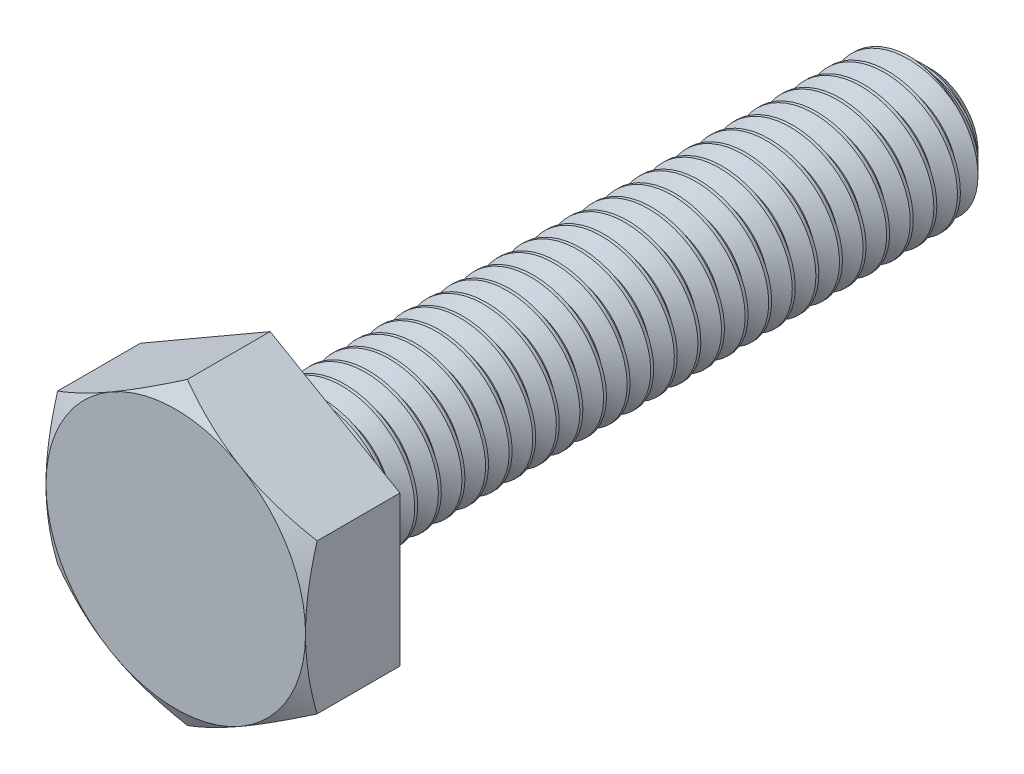
from build123d import *
from build123d.topology import SkipClean

# Parameters (mm, degrees)
SKETCH2_R           = 1.5
BOSS_EXTRUDE1_DEPTH = 14
BOSS_EXTRUDE2_DEPTH = 2
SKETCH4_OUTSIDE_W   = 71.882
SKETCH4_OUTSIDE_H   = 72.732
SKETCH4_OUTSIDE_R   = 2.75
CUT_EXTRUDE1_DEPTH  = 17.542243903
CUT_EXTRUDE1_DRAFT  = -60
CHAMFER1_SIZE       = 0.5
CUT_SWEEP2_PITCH    = 0.5
SKETCH7_R           = 1.5
BOSS_EXTRUDE5_DEPTH = 2


with BuildPart() as part:
    # Sketch2 → Boss-Extrude1 (new body)
    with BuildSketch(Plane.XY.offset(7)):
        Circle(SKETCH2_R)
    extrude(amount=-BOSS_EXTRUDE1_DEPTH)

    # Chamfer1
    chamfer1_edges = [part.edges().sort_by_distance(p)[0] for p in [
        (-1.5, 0, -7),
    ]]
    chamfer(chamfer1_edges, length=CHAMFER1_SIZE)

    # Cut-Sweep2: the profile of Sketch8 screwed along a right-hand helix of 29 turns, 6 arcs to a turn; built about Z, then put on its axis
    cut_sweep2_z = Axis((0, 0, 0), (0, 0, 1))
    cut_sweep2_corners = [(1.527063294, 0, 0.015625), (1.527063294, 0, -0.453125), (1.175240474, 0, -0.25), (1.175240474, 0, -0.1875)]
    with BuildLine(mode=Mode.PRIVATE) as cut_sweep2_profile:
        Line(cut_sweep2_corners[0], cut_sweep2_corners[1])
        Line(cut_sweep2_corners[1], cut_sweep2_corners[2])
        Line(cut_sweep2_corners[2], cut_sweep2_corners[3])
        Line(cut_sweep2_corners[3], cut_sweep2_corners[0])
    cut_sweep2_cap = Face(cut_sweep2_profile.wire())
    cut_sweep2_turn_angles = [0, 30, 60, 90, 120, 150, 180, 210, 240, 270, 300, 330, 360]
    cut_sweep2_turn_weights = [1, 0.8660254037844387, 1, 0.8660254037844387, 1, 0.8660254037844387, 1, 0.8660254037844387, 1, 0.8660254037844387, 1, 0.8660254037844387, 1]
    cut_sweep2_turn_rails = [Edge.make_bspline([Vector(p[0], p[1], 0).rotate(cut_sweep2_z, cut_sweep2_turn_angles[k]) / cut_sweep2_turn_weights[k] + Vector(0, 0, p[2] + CUT_SWEEP2_PITCH * cut_sweep2_turn_angles[k] / 360) for k in range(13)], [0, 0, 0, 1, 1, 2, 2, 3, 3, 4, 4, 5, 5, 6, 6, 6], 2, cut_sweep2_turn_weights) for p in cut_sweep2_corners]
    cut_sweep2_turn_sides = [Face.make_surface_from_curves(cut_sweep2_turn_rails[p[0]], cut_sweep2_turn_rails[p[1]]) for p in [(0, 1), (1, 2), (2, 3), (3, 0)]]
    cut_sweep2 = Plane(origin=(0, 0, -7), x_dir=(0, 1, 0), z_dir=(0, 0, 1)) * Solid(Shell([*[p.moved(Location((0, 0, CUT_SWEEP2_PITCH * i))) for i in range(29) for p in cut_sweep2_turn_sides], cut_sweep2_cap, cut_sweep2_cap.rotate(cut_sweep2_z, 10440).moved(Location((0, 0, CUT_SWEEP2_PITCH * 10440 / 360)))]))
    add(cut_sweep2, mode=Mode.SUBTRACT)



with BuildPart() as body_2:
    # Sketch3 → Boss-Extrude2 (new body)
    with BuildSketch(Plane.XY.offset(7)):
        Polygon((0, 3.175426481), (-2.75, 1.58771324), (-2.75, -1.58771324), (0, -3.175426481), (2.75, -1.58771324), (2.75, 1.58771324), align=None)
    extrude(amount=BOSS_EXTRUDE2_DEPTH)


with BuildPart() as cut_extrude1_tool:
    # Sketch4 outside → Cut-Extrude1 (with draft: the straight prism first)
    with BuildSketch(Plane.XY.offset(9)):
        Rectangle(SKETCH4_OUTSIDE_W, SKETCH4_OUTSIDE_H)
        Circle(SKETCH4_OUTSIDE_R, mode=Mode.SUBTRACT)
    extrude(amount=-CUT_EXTRUDE1_DEPTH)
    # Cut-Extrude1: the draft: its side faces are tilted about the plane it starts from
    cut_extrude1_sides = [cut_extrude1_tool.faces().sort_by_distance(p)[0] for p in [
        (0, -36.366, 0.228878049),
        (35.941, 0, 0.228878049),
        (0, 36.366, 0.228878049),
        (-35.941, 0, 0.228878049),
        (-2.75, 0, 0.228878049),
    ]]
    draft(cut_extrude1_sides, Plane.XY.offset(9), CUT_EXTRUDE1_DRAFT)


with BuildPart() as body_2_1:
    add(body_2.part)

    # Cut-Extrude1: cut by cut_extrude1_tool
    add(cut_extrude1_tool.part, mode=Mode.SUBTRACT)


with BuildPart() as part_1:
    with SkipClean():  # the faces are left unmerged after this step: merging them gives an invalid solid
        add(part.part)

        add(body_2_1.part)  # Boss-Extrude5 merges body 2
        # Sketch7 → Boss-Extrude5 (add)
        with BuildSketch(Plane(origin=(0, 0, 9), x_dir=(-1, 0, 0), z_dir=(0, 0, -1))):
            Circle(SKETCH7_R)
        extrude(amount=BOSS_EXTRUDE5_DEPTH)


solid = part_1.part
